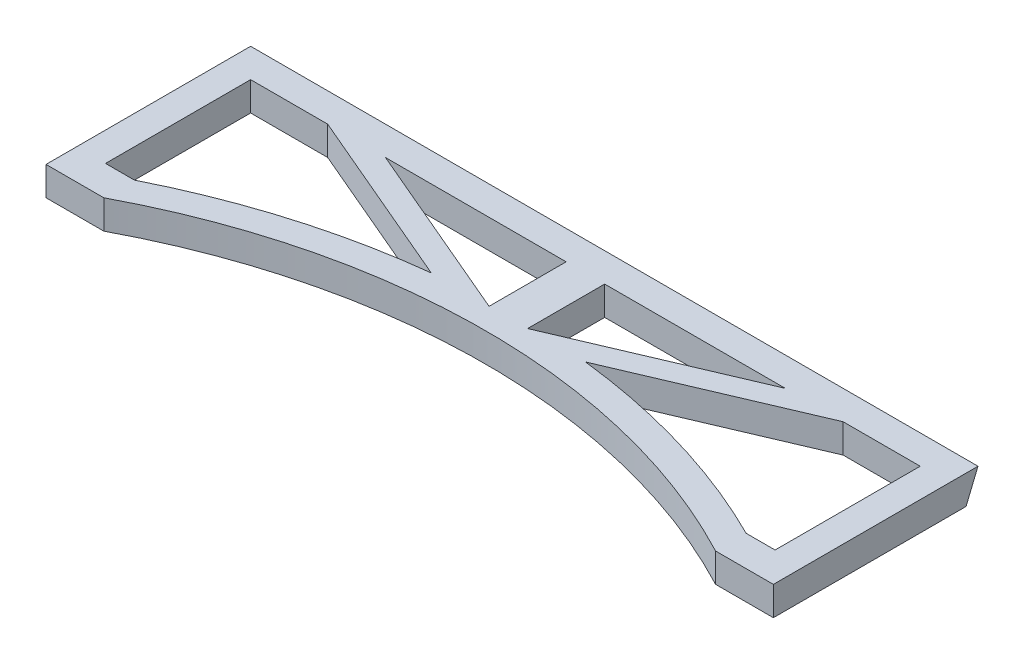
from build123d import *

# Parameters (mm, degrees)
BOSS_EXTRUDE1_DEPTH = 9.525
CHAMFER1_SIZE2      = 3.93484735
CHAMFER1_SIZE       = 9.525
CUT_EXTRUDE1_DEPTH  = 138.853926046


with BuildPart() as part:
    # Sketch1 → Boss-Extrude1 (new body)
    with BuildSketch(Plane(origin=(0, 0, 0), x_dir=(1, 0, 0), z_dir=(0, 1, 0))):
        with BuildLine():
            Line((-119.85625, 0), (119.85625, 0))
            Line((119.85625, 0), (119.85625, -67.43484735))
            Line((119.85625, -67.43484735), (100.80625, -67.43484735))
            ThreePointArc((100.80625, -67.43484735), (0, -42.456061365), (-100.80625, -67.43484735))
            Line((-100.80625, -67.43484735), (-119.85625, -67.43484735))
            Line((-119.85625, -67.43484735), (-119.85625, 0))
        make_face()
    extrude(amount=BOSS_EXTRUDE1_DEPTH)

    # Chamfer1
    chamfer1_edges = [part.edges().sort_by_distance(p)[0] for p in [
        (0, 0, 0),
    ]]
    chamfer1_side = [part.faces().sort_by_distance(p)[0] for p in [
        (0, 0.078696947, 0),
    ]]
    chamfer(chamfer1_edges, length=CHAMFER1_SIZE - 0.0001, length2=CHAMFER1_SIZE2 - 0.0001, reference=chamfer1_side[0])  # a hair under: the kernel refuses the full size

    # Sketch3 → Cut-Extrude1 (cut, through all)
    with BuildSketch(Plane(origin=(0, 9.525, 0), x_dir=(1, 0, 0), z_dir=(0, 1, 0))):
        with BuildLine():
            Line((-110.33125, -57.346859726), (-110.33125, -9.525))
            Line((-110.33125, -9.525), (-84.93125, -9.525))
            Line((-84.93125, -9.525), (-25.4, -34.925))
            ThreePointArc((-25.4, -34.925), (-64.091257853, -42.812771399), (-100.80625, -57.346859726))
            Line((-100.80625, -57.346859726), (-110.33125, -57.346859726))
        make_face()
        Polygon((-65.88125, -9.525), (-6.35, -34.925), (-6.35, -9.525), align=None)
        with BuildLine():
            Line((110.33125, -57.346859726), (100.80625, -57.346859726))
            ThreePointArc((100.80625, -57.346859726), (64.091257853, -42.812771399), (25.4, -34.925))
            Line((25.4, -34.925), (84.93125, -9.525))
            Line((84.93125, -9.525), (110.33125, -9.525))
            Line((110.33125, -9.525), (110.33125, -57.346859726))
        make_face()
        Polygon((6.35, -9.525), (65.88125, -9.525), (6.35, -34.925), align=None)
    extrude(amount=-CUT_EXTRUDE1_DEPTH, mode=Mode.SUBTRACT)


solid = part.part
